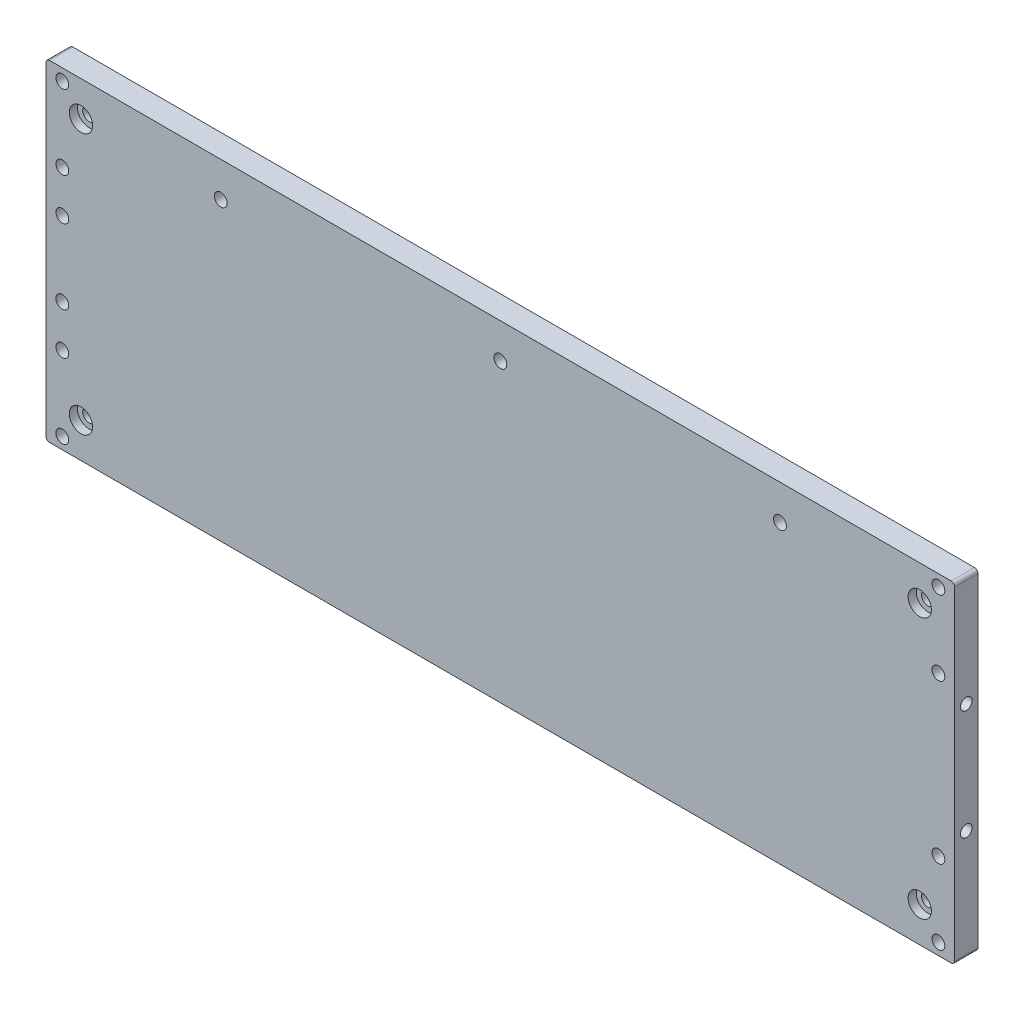
from build123d import *

# Parameters (mm, degrees)
SKETCH1_W           = 390
SKETCH1_H           = 142
BOSS_EXTRUDE1_DEPTH = 5
SKETCH2_R           = 2.75
CUT_EXTRUDE1_DEPTH  = 208.764289521
SKETCH3_R           = 2.75
CUT_EXTRUDE2_DEPTH  = 208.764289521
SKETCH4_R           = 5
CUT_EXTRUDE3_DEPTH  = 3.5
SKETCH5_R           = 2.5
CUT_EXTRUDE4_DEPTH  = 10
SKETCH6_R           = 2.75
CUT_EXTRUDE5_DEPTH  = 208.764289521
FILLET1_R           = 1.5


with BuildPart() as part:
    # Sketch1 → Boss-Extrude1 (new, symmetric)
    with BuildSketch(Plane.XY):
        Rectangle(SKETCH1_W, SKETCH1_H)
    extrude(amount=BOSS_EXTRUDE1_DEPTH, both=True)

    # Sketch2 → Cut-Extrude1 (cut, through all)
    with BuildSketch(Plane(origin=(0, 0, -5), x_dir=(-1, 0, 0), z_dir=(0, 0, -1))):
        with Locations((-188, 66)):
            Circle(SKETCH2_R)
        with Locations((-188, -66)):
            Circle(SKETCH2_R)
        with Locations((188, 66)):
            Circle(SKETCH2_R)
        with Locations((188, -66)):
            Circle(SKETCH2_R)
        with Locations((-188, 34)):
            Circle(SKETCH2_R)
        with Locations((-188, -34)):
            Circle(SKETCH2_R)
        with Locations((188, 34)):
            Circle(SKETCH2_R)
        with Locations((188, -34)):
            Circle(SKETCH2_R)
    extrude(amount=-CUT_EXTRUDE1_DEPTH, mode=Mode.SUBTRACT)

    # Sketch3 → Cut-Extrude2 (cut, through all)
    with BuildSketch(Plane.XY.offset(5)):
        with Locations((-180, 56)):
            Circle(SKETCH3_R)
        with Locations((180, 56)):
            Circle(SKETCH3_R)
        with Locations((180, -56)):
            Circle(SKETCH3_R)
        with Locations((-180, -56)):
            Circle(SKETCH3_R)
        with Locations((0, 56)):
            Circle(SKETCH3_R)
        with Locations((-120, 56)):
            Circle(SKETCH3_R)
        with Locations((120, 56)):
            Circle(SKETCH3_R)
    extrude(amount=-CUT_EXTRUDE2_DEPTH, mode=Mode.SUBTRACT)

    # Sketch4 → Cut-Extrude3 (cut)
    with BuildSketch(Plane.XY.offset(5)):
        with Locations((-180, 56)):
            Circle(SKETCH4_R)
        with Locations((-180, -56)):
            Circle(SKETCH4_R)
        with Locations((180, 56)):
            Circle(SKETCH4_R)
        with Locations((180, -56)):
            Circle(SKETCH4_R)
    extrude(amount=-CUT_EXTRUDE3_DEPTH, mode=Mode.SUBTRACT)

    # Sketch5 → Cut-Extrude4 (cut)
    with BuildSketch(Plane(origin=(195, 0, 0), x_dir=(0, 0, -1), z_dir=(1, 0, 0))):
        with Locations((0, 23.6)):
            Circle(SKETCH5_R)
        with Locations((0, -23.6)):
            Circle(SKETCH5_R)
    extrude(amount=-CUT_EXTRUDE4_DEPTH, mode=Mode.SUBTRACT)

    # Sketch6 → Cut-Extrude5 (cut, through all)
    with BuildSketch(Plane.XY.offset(5)):
        with Locations((-188, 16)):
            Circle(SKETCH6_R)
        with Locations((-188, -16)):
            Circle(SKETCH6_R)
    extrude(amount=-CUT_EXTRUDE5_DEPTH, mode=Mode.SUBTRACT)

    # Fillet1
    fillet1_edges = [part.edges().sort_by_distance(p)[0] for p in [
        (-195, -71, 0),
        (195, -71, 0),
        (195, 71, 0),
        (-195, 71, 0),
    ]]
    fillet(fillet1_edges, radius=FILLET1_R)


solid = part.part
